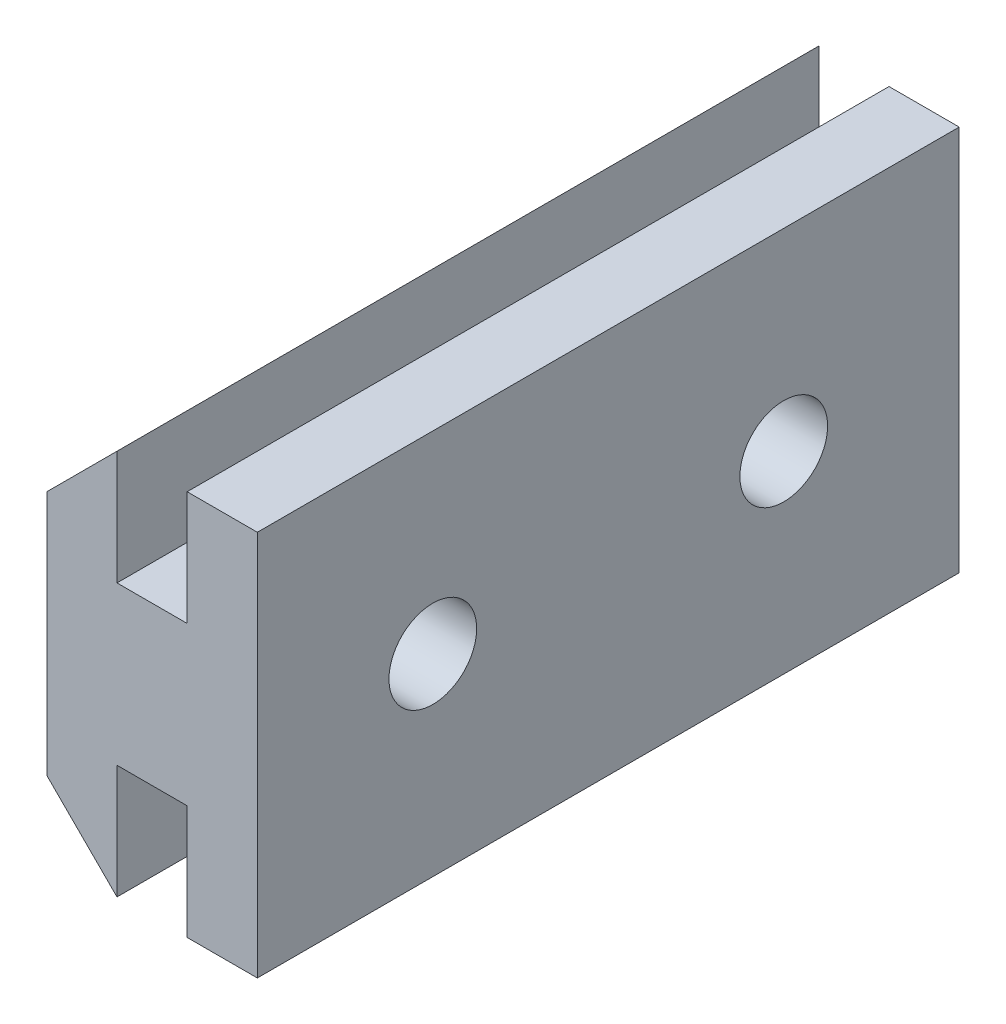
from build123d import *

# Parameters (mm, degrees)
BOSS_EXTRU_1_DEPTH      = 20
ESQUISSE1_R             = 1.25
ENL_V_MAT_EXTRU_1_DEPTH = 23.272460574


with BuildPart() as part:
    # ProfileRainureEsquisse → Boss.-Extru.1 (new body)
    with BuildSketch(Plane.XY):
        Polygon((-0.4, -1.25), (-0.4, 5.75), (1.6, 7.75), (1.6, 4.5), (3.6, 4.5), (3.6, 7.75), (5.6, 7.75), (5.6, -3.25), (3.6, -3.25), (3.6, 0), (1.6, 0), (1.6, -3.25), align=None)
    extrude(amount=BOSS_EXTRU_1_DEPTH)

    # Esquisse1 → Enlèv. mat.-Extru.1 (cut, through all)
    with BuildSketch(Plane(origin=(5.6, 0, 0), x_dir=(0, 0, -1), z_dir=(1, 0, 0))):
        with Locations((-15, 2.25)):
            Circle(ESQUISSE1_R)
        with Locations((-5, 2.25)):
            Circle(ESQUISSE1_R)
    extrude(amount=-ENL_V_MAT_EXTRU_1_DEPTH, mode=Mode.SUBTRACT)


solid = part.part
